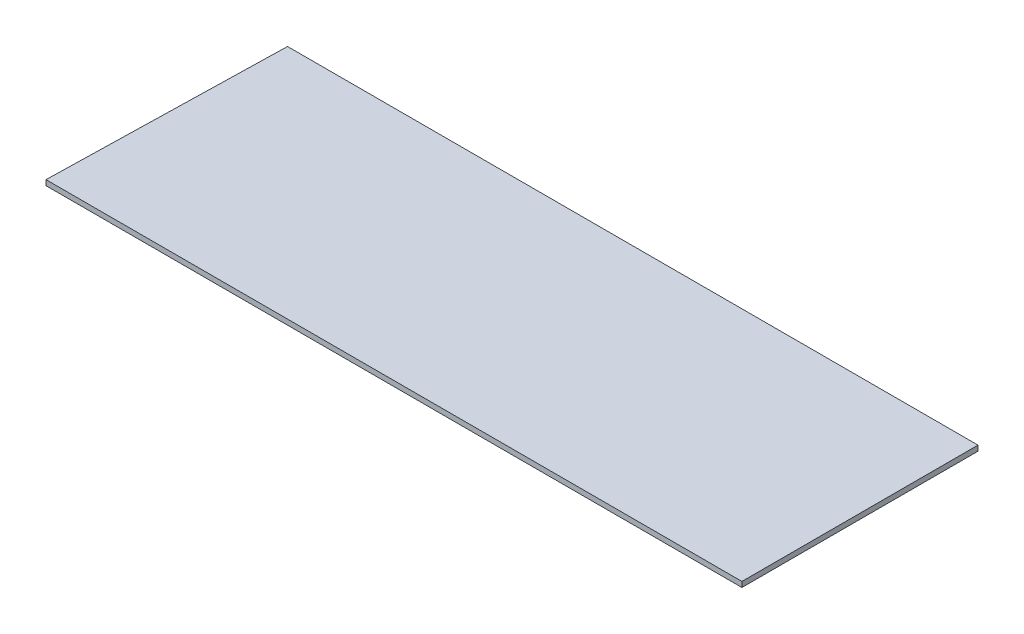
from build123d import *

# Parameters (mm, degrees)
SKETCH1_W           = 790
SKETCH1_H           = 134
BOSS_EXTRUDE1_DEPTH = 3
SPLIT1_START        = -321.26735161
SPLIT1_OUTLINE_W    = 3
SPLIT1_OUTLINE_H    = 147
SPLIT1_DEPTH        = 397.997008775


# Read off the part's stored shape, not the designer's step: Split1
with BuildPart() as part:
    # Sketch1 → Boss-Extrude1 (new body)
    with BuildSketch(Plane(origin=(0, 0, 0), x_dir=(1, 0, 0), z_dir=(0, 1, 0))):
        with Locations((76.3640553, 50.32718894)):
            Rectangle(SKETCH1_W, SKETCH1_H)
    extrude(amount=BOSS_EXTRUDE1_DEPTH)

    # Split1 outline → Split1 (cut)
    with BuildSketch(Plane(origin=(0, 0, 0), x_dir=(0, 1, 0), z_dir=(0.9997318604438431, 0, 0.023156148502985304)).offset(SPLIT1_START)):
        with Locations((1.5, -47.5)):
            Rectangle(SPLIT1_OUTLINE_W, SPLIT1_OUTLINE_H)
    extrude(amount=SPLIT1_DEPTH, mode=Mode.SUBTRACT)


solid = part.part
